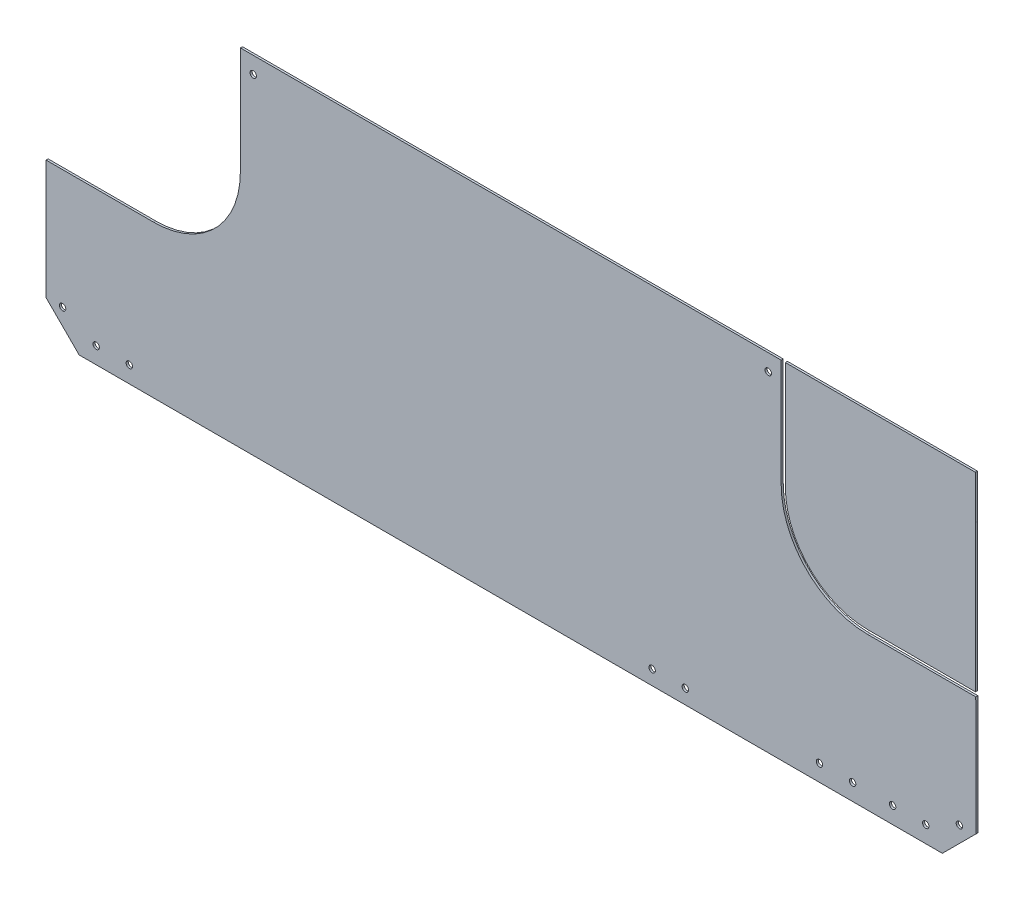
from build123d import *

# Parameters (mm, degrees)
SKETCH3_W                              = 914.4
SKETCH3_H                              = 609.6
BOSS_EXTRUDE1_DEPTH                    = 0.79375
CUT_EXTRUDE1_DEPTH                     = 2.54
CUT_EXTRUDE2_DEPTH                     = 2.54
CUT_EXTRUDE3_DEPTH                     = 2.54
SKETCH11_W                             = 2.45745
SKETCH11_H                             = 1.5875
F_10_0_1935_DIAMETER_HOLE1_AT_2_COUNT  = 2
F_10_0_1935_DIAMETER_HOLE1_AT_2_PITCH  = 25.4
F_10_0_1935_DIAMETER_HOLE1_AT_3_COUNT  = 2
F_10_0_1935_DIAMETER_HOLE1_AT_3_PITCH  = 52.708494186
F_10_0_1935_DIAMETER_HOLE1_AT_4_COUNT  = 2
F_10_0_1935_DIAMETER_HOLE1_AT_4_PITCH  = 609.955600508
F_10_0_1935_DIAMETER_HOLE1_AT_5_COUNT  = 2
F_10_0_1935_DIAMETER_HOLE1_AT_5_PITCH  = 584.555600508
F_10_0_1935_DIAMETER_HOLE1_AT_6_COUNT  = 2
F_10_0_1935_DIAMETER_HOLE1_AT_6_PITCH  = 635.838045264
F_10_0_1935_DIAMETER_HOLE1_AT_7_COUNT  = 2
F_10_0_1935_DIAMETER_HOLE1_AT_7_PITCH  = 545.026051512
F_10_0_1935_DIAMETER_HOLE1_AT_8_COUNT  = 2
F_10_0_1935_DIAMETER_HOLE1_AT_8_PITCH  = 258.142956966
F_10_0_1935_DIAMETER_HOLE1_AT_9_COUNT  = 2
F_10_0_1935_DIAMETER_HOLE1_AT_9_PITCH  = 400.399832669
F_10_0_1935_DIAMETER_HOLE1_AT_10_COUNT = 2
F_10_0_1935_DIAMETER_HOLE1_AT_10_PITCH = 425.799644939
F_10_0_1935_DIAMETER_HOLE1_AT_11_COUNT = 2
F_10_0_1935_DIAMETER_HOLE1_AT_11_PITCH = 528.540668987
F_10_0_1935_DIAMETER_HOLE1_AT_12_COUNT = 2
F_10_0_1935_DIAMETER_HOLE1_AT_12_PITCH = 553.940668987


with BuildPart() as part:
    # Sketch3 → Boss-Extrude1 (new, symmetric)
    with BuildSketch(Plane.XY):
        Rectangle(SKETCH3_W, SKETCH3_H)
    extrude(amount=BOSS_EXTRUDE1_DEPTH, both=True)

    # Sketch4 → Cut-Extrude1 (cut)
    with BuildSketch(Plane.XY.offset(0.79375)):
        Polygon((-378.246738216, -279.4), (-378.246738216, -39.370452154), (333.614037385, -39.370452154), (333.980724384, -279.084337387), (308.265061771, -304.8), (334.020061276, -304.8), (457.2, -304.8), (457.2, 304.8), (-457.2, 304.8), (-457.2, -304.8), (-378.246738216, -304.8), (-352.846738216, -304.8), align=None)
    extrude(amount=-CUT_EXTRUDE1_DEPTH, mode=Mode.SUBTRACT)

    # Sketch7 → Cut-Extrude2 (cut)
    with BuildSketch(Plane.XY.offset(0.79375)):
        with BuildLine():
            Line((-378.246738216, -188.190344021), (-378.246738216, -39.346344021))
            Line((-378.246738216, -39.346344021), (-229.402738216, -39.346344021))
            Line((-229.402738216, -39.346344021), (-229.402738216, -64.746344021))
            Line((-229.402738216, -64.746344021), (-229.402738216, -121.896344021))
            ThreePointArc((-229.402738216, -121.896344021), (-248.819801264, -168.773280973), (-295.696738216, -188.190344021))
            Line((-295.696738216, -188.190344021), (-352.846738216, -188.190344021))
            Line((-352.846738216, -188.190344021), (-378.246738216, -188.190344021))
        make_face()
    extrude(amount=-CUT_EXTRUDE2_DEPTH, mode=Mode.SUBTRACT)

    # Sketch8 → Cut-Extrude3 (cut)
    with BuildSketch(Plane.XY.offset(0.79375)):
        with BuildLine():
            Line((251.115061771, -188.190344021), (336.840061771, -188.190344021))
            Line((336.840061771, -188.190344021), (336.840061771, -36.171344021))
            Line((336.840061771, -36.171344021), (184.821061771, -36.171344021))
            Line((184.821061771, -36.171344021), (184.821061771, -121.896344021))
            ThreePointArc((184.821061771, -121.896344021), (204.238124819, -168.773280973), (251.115061771, -188.190344021))
        make_face()
        with BuildLine():
            Line((251.115061771, -185.015344021), (333.665061771, -185.015344021))
            Line((333.665061771, -185.015344021), (333.665061771, -39.346344021))
            Line((333.665061771, -39.346344021), (187.996061771, -39.346344021))
            Line((187.996061771, -39.346344021), (187.996061771, -121.896344021))
            ThreePointArc((187.996061771, -121.896344021), (206.483188849, -166.528216943), (251.115061771, -185.015344021))
        make_face(mode=Mode.SUBTRACT)
    extrude(amount=-CUT_EXTRUDE3_DEPTH, mode=Mode.SUBTRACT)


with BuildPart() as cut_extrude3_piece_1:
    # of the separate pieces the step leaves, piece 1, a body of its own (cut_extrude3_pieces)
    add(part.part.solids().sort_by_distance((308.265061771, -304.8, 0.79375))[0])

    # Sketch11 → #10 (0.1935) Diameter Hole1 (revolve, cut)
    with BuildSketch(Plane(origin=(-314.391138724, -292.114748821, 0.79375), x_dir=(0, -1, 0), z_dir=(1, 0, 0))):
        with Locations((1.228725, 0.79375)):
            Rectangle(SKETCH11_W, SKETCH11_H)
    f_10_0_1935_diameter_hole1 = revolve(axis=Axis((-314.391138724, -292.114748821, 7.14375), (0, 0, -1)), mode=Mode.SUBTRACT)

    # #10 (0.1935) Diameter Hole1 at 2: #10 (0.1935) Diameter Hole1 ×2
    with Locations(*[(-i * F_10_0_1935_DIAMETER_HOLE1_AT_2_PITCH, 0, 0) for i in range(1, F_10_0_1935_DIAMETER_HOLE1_AT_2_COUNT)]):
        add(f_10_0_1935_diameter_hole1, mode=Mode.SUBTRACT)

    # #10 (0.1935) Diameter Hole1 at 3: #10 (0.1935) Diameter Hole1 ×2
    with Locations(*[Vector(-0.9705380561850375, 0.2409478812867402, 0) * (i * F_10_0_1935_DIAMETER_HOLE1_AT_3_PITCH) for i in range(1, F_10_0_1935_DIAMETER_HOLE1_AT_3_COUNT)]):
        add(f_10_0_1935_diameter_hole1, mode=Mode.SUBTRACT)

    # #10 (0.1935) Diameter Hole1 at 4: #10 (0.1935) Diameter Hole1 ×2
    with Locations(*[(i * F_10_0_1935_DIAMETER_HOLE1_AT_4_PITCH, 0, 0) for i in range(1, F_10_0_1935_DIAMETER_HOLE1_AT_4_COUNT)]):
        add(f_10_0_1935_diameter_hole1, mode=Mode.SUBTRACT)

    # #10 (0.1935) Diameter Hole1 at 5: #10 (0.1935) Diameter Hole1 ×2
    with Locations(*[(i * F_10_0_1935_DIAMETER_HOLE1_AT_5_PITCH, 0, 0) for i in range(1, F_10_0_1935_DIAMETER_HOLE1_AT_5_COUNT)]):
        add(f_10_0_1935_diameter_hole1, mode=Mode.SUBTRACT)

    # #10 (0.1935) Diameter Hole1 at 6: #10 (0.1935) Diameter Hole1 ×2
    with Locations(*[Vector(0.9998005069605744, 0.01997363966277868, 0) * (i * F_10_0_1935_DIAMETER_HOLE1_AT_6_PITCH) for i in range(1, F_10_0_1935_DIAMETER_HOLE1_AT_6_COUNT)]):
        add(f_10_0_1935_diameter_hole1, mode=Mode.SUBTRACT)

    # #10 (0.1935) Diameter Hole1 at 7: #10 (0.1935) Diameter Hole1 ×2
    with Locations(*[Vector(0.8977666281056725, 0.44047143092347246, 0) * (i * F_10_0_1935_DIAMETER_HOLE1_AT_7_PITCH) for i in range(1, F_10_0_1935_DIAMETER_HOLE1_AT_7_COUNT)]):
        add(f_10_0_1935_diameter_hole1, mode=Mode.SUBTRACT)

    # #10 (0.1935) Diameter Hole1 at 8: #10 (0.1935) Diameter Hole1 ×2
    with Locations(*[Vector(0.3676040656829352, 0.929982392786754, 0) * (i * F_10_0_1935_DIAMETER_HOLE1_AT_8_PITCH) for i in range(1, F_10_0_1935_DIAMETER_HOLE1_AT_8_COUNT)]):
        add(f_10_0_1935_diameter_hole1, mode=Mode.SUBTRACT)

    # #10 (0.1935) Diameter Hole1 at 9: #10 (0.1935) Diameter Hole1 ×2
    with Locations(*[Vector(0.9999921402016424, -0.0039647868717924035, 0) * (i * F_10_0_1935_DIAMETER_HOLE1_AT_9_PITCH) for i in range(1, F_10_0_1935_DIAMETER_HOLE1_AT_9_COUNT)]):
        add(f_10_0_1935_diameter_hole1, mode=Mode.SUBTRACT)

    # #10 (0.1935) Diameter Hole1 at 10: #10 (0.1935) Diameter Hole1 ×2
    with Locations(*[Vector(0.9999930499425977, -0.0037282792949751764, 0) * (i * F_10_0_1935_DIAMETER_HOLE1_AT_10_PITCH) for i in range(1, F_10_0_1935_DIAMETER_HOLE1_AT_10_COUNT)]):
        add(f_10_0_1935_diameter_hole1, mode=Mode.SUBTRACT)

    # #10 (0.1935) Diameter Hole1 at 11: #10 (0.1935) Diameter Hole1 ×2
    with Locations(*[(i * F_10_0_1935_DIAMETER_HOLE1_AT_11_PITCH, 0, 0) for i in range(1, F_10_0_1935_DIAMETER_HOLE1_AT_11_COUNT)]):
        add(f_10_0_1935_diameter_hole1, mode=Mode.SUBTRACT)

    # #10 (0.1935) Diameter Hole1 at 12: #10 (0.1935) Diameter Hole1 ×2
    with Locations(*[(i * F_10_0_1935_DIAMETER_HOLE1_AT_12_PITCH, 0, 0) for i in range(1, F_10_0_1935_DIAMETER_HOLE1_AT_12_COUNT)]):
        add(f_10_0_1935_diameter_hole1, mode=Mode.SUBTRACT)


with BuildPart() as cut_extrude3_piece_2:
    # of the separate pieces the step leaves, piece 2, a body of its own (cut_extrude3_pieces)
    add(part.part.solids().sort_by_distance((333.614037385, -39.370452154, 0.79375))[0])


solid = Compound([cut_extrude3_piece_1.part, cut_extrude3_piece_2.part])
